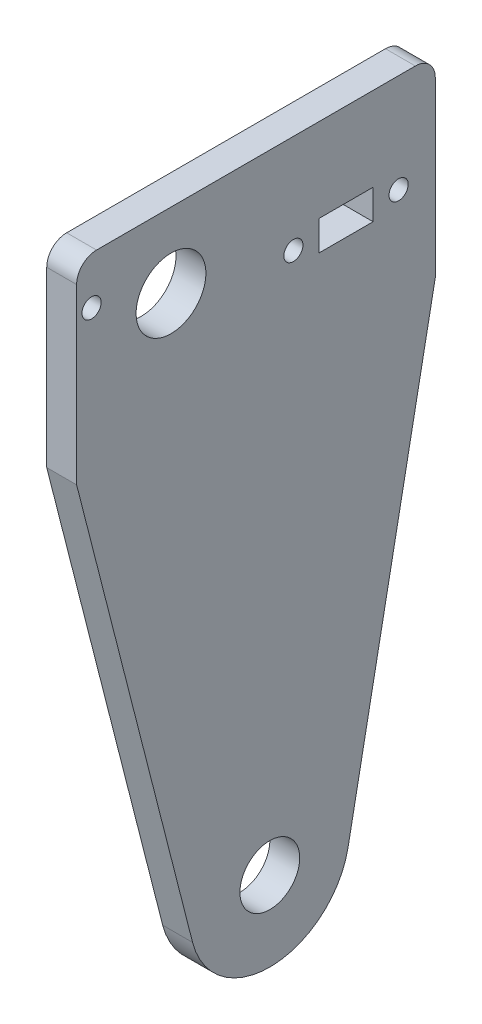
from build123d import *

# Parameters (mm, degrees)
SKETCH1_R           = 4.7625
SKETCH1_R_2         = 5.5626
SKETCH1_R_3         = 1.524
SKETCH1_W           = 8.636
SKETCH1_H           = 4.7625
BOSS_EXTRUDE1_DEPTH = 4.7625


with BuildPart() as part:
    # Sketch1 → Boss-Extrude1 (new body)
    with BuildSketch(Plane(origin=(0, 0, 0), x_dir=(0, 0, -1), z_dir=(1, 0, 0))):
        with BuildLine():
            Line((42.1132, 8.7376), (42.1132, -18.894289209))
            Line((42.1132, -18.894289209), (28.215665755, -90.567816907))
            ThreePointArc((28.215665755, -90.567816907), (16.118595392, -100.844895312), (3.442418163, -91.291258163))
            Line((3.442418163, -91.291258163), (-15.0368, -18.894289209))
            Line((-15.0368, -18.894289209), (-15.0368, 8.7376))
            ThreePointArc((-15.0368, 8.7376), (-14.10686403, 10.98266403), (-11.8618, 11.9126))
            Line((-11.8618, 11.9126), (38.9382, 11.9126))
            ThreePointArc((38.9382, 11.9126), (41.18326403, 10.98266403), (42.1132, 8.7376))
        make_face()
        with Locations((15.747881426, -88.15030705)):
            Circle(SKETCH1_R, mode=Mode.SUBTRACT)
        Circle(SKETCH1_R_2, mode=Mode.SUBTRACT)
        with Locations((-12.65555, 4.3307)):
            Circle(SKETCH1_R_3, mode=Mode.SUBTRACT)
        with Locations((36.2712, -3.8354)):
            Circle(SKETCH1_R_3, mode=Mode.SUBTRACT)
        with Locations((19.5072, -3.8354)):
            Circle(SKETCH1_R_3, mode=Mode.SUBTRACT)
        with Locations((27.8892, -3.8354)):
            Rectangle(SKETCH1_W, SKETCH1_H, mode=Mode.SUBTRACT)
    extrude(amount=BOSS_EXTRUDE1_DEPTH)


solid = part.part
